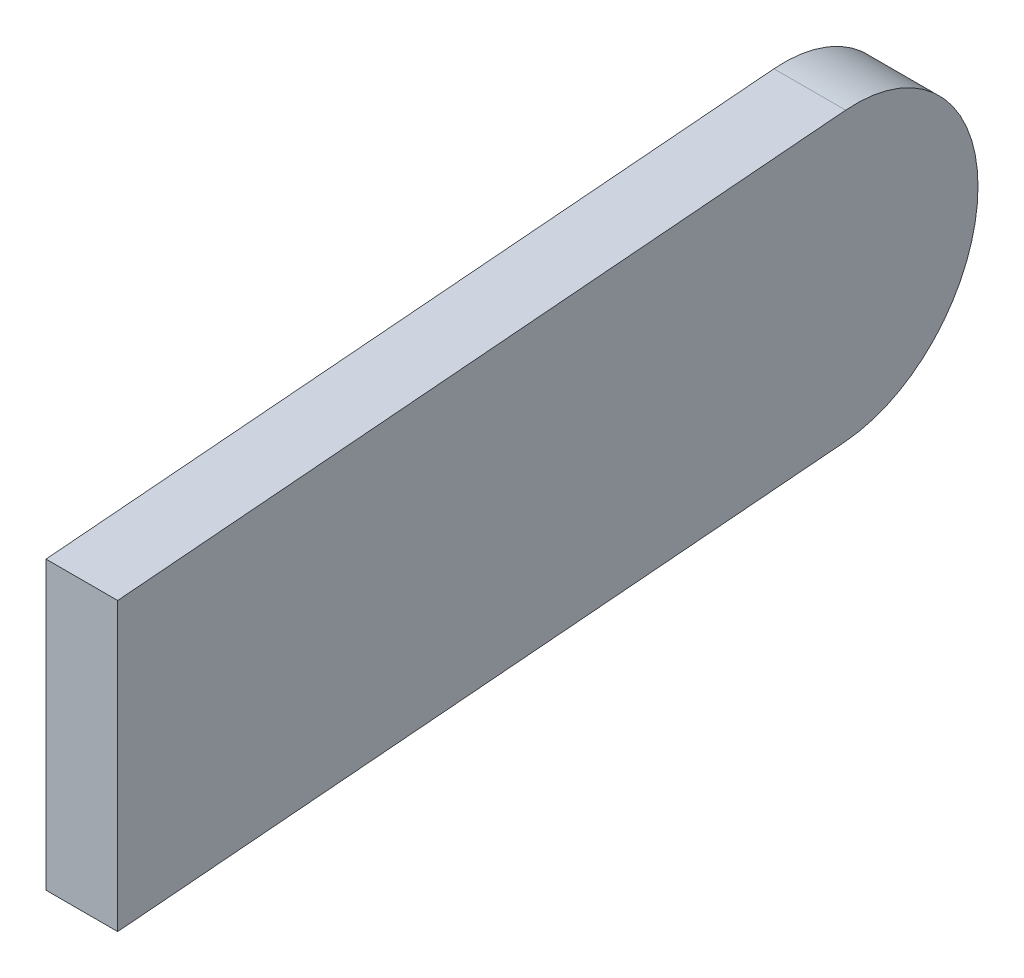
from build123d import *

# Parameters (mm, degrees)
BOSS_EXTRUDE1_DEPTH = 0.4
FILLET1_R           = 0.4


with BuildPart() as part:
    # Sketch1 → Boss-Extrude1 (new, symmetric)
    with BuildSketch(Plane(origin=(0, 0, 0), x_dir=(1, 0, 0), z_dir=(0, 1, 0))):
        Polygon((-0.2, 1.3), (0, 1.3), (0.2, -1.3), (0, -1.3), align=None)
    extrude(amount=BOSS_EXTRUDE1_DEPTH, both=True)

    # Fillet1
    fillet1_edges = [part.edges().sort_by_distance(p)[0] for p in [
        (-0.1, 0.4, -1.3),
        (-0.1, -0.4, -1.3),
    ]]
    fillet(fillet1_edges, radius=FILLET1_R - 0.0001)  # a hair under: the kernel refuses the full size


solid = part.part
